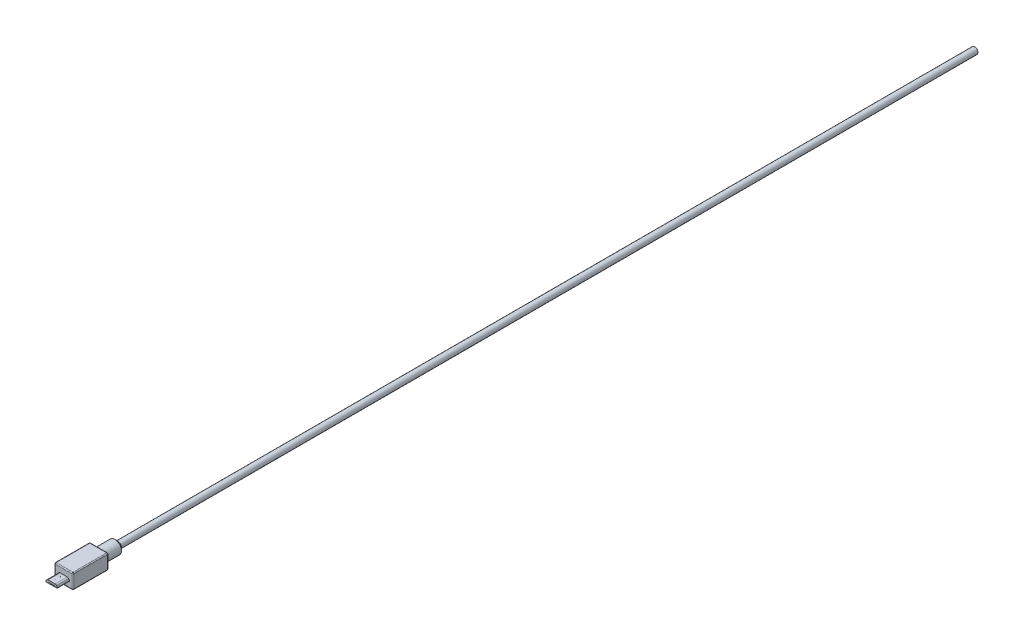
from build123d import *

# Parameters (mm, degrees)
SKETCH1_W                             = 10
SKETCH1_H                             = 19
MAIN_BODY_DEPTH                       = 8
WIRE_ENCAPSULATE_DEPTH                = 10
WIRE_ENCAPSULATE_DEPTH_BACK           = 2
SKETCH2_R                             = 3.5
WIRE_START_SIZE                       = 1.5
MUSB_CONNECTOR_PROFILE_EXTERNAL_DEPTH = 6.5
MUSB_CONNECTOR_PROFILE_INTERNAL_DEPTH = 6.5
SKETCH9_W                             = 3.5
SKETCH9_H                             = 0.5
PIN_ACCESS_DEPTH                      = 6.5
CONTACT_PIN_DEPTH                     = 6
CP_L_COUNT                            = 3
CP_L_PITCH                            = 0.5
CP_L_COL_COUNT                        = 3
CP_L_COL_PITCH                        = 0.5
SHEET_METAL_BOTTOM_MERGE_DEPTH        = 0.02
SKETCH27_W                            = 0.2
SKETCH27_H                            = 5.4
TAB_CUTOUT_DEPTH                      = 0.01
LOCKING_TAB_DEPTH                     = 0.2
WIRE_START                            = -479.5
WIRE_2_OUTLINE_R                      = 1.75
WIRE_2_DEPTH                          = 460
MB_F_R                                = 0.5


# Read off the part's stored shape, not the designer's step: WIRE
with BuildPart() as part:
    # Sketch1 → MAIN BODY (new body)
    with BuildSketch(Plane(origin=(0, 0, 0), x_dir=(1, 0, 0), z_dir=(0, 1, 0))):
        Rectangle(SKETCH1_W, SKETCH1_H)
    extrude(amount=MAIN_BODY_DEPTH)

    # Sketch2 → WIRE ENCAPSULATE (add, two sides: drawn at the far end of the back side and taken through both)
    with BuildSketch(Plane(origin=(0, 0, -9.5), x_dir=(-1, 0, 0), z_dir=(0, 0, -1)).offset(-WIRE_ENCAPSULATE_DEPTH_BACK)):
        with Locations((0, 4)):
            Circle(SKETCH2_R)
    extrude(amount=WIRE_ENCAPSULATE_DEPTH + WIRE_ENCAPSULATE_DEPTH_BACK)

    # WIRE START
    wire_start_edges = [part.edges().sort_by_distance(p)[0] for p in [
        (3.5, 4, -19.5),
    ]]
    chamfer(wire_start_edges, length=WIRE_START_SIZE)

    # WIRE 2 outline → WIRE 2 (add)
    with BuildSketch(Plane.XY.offset(WIRE_START)):
        with Locations((0, 4)):
            Circle(WIRE_2_OUTLINE_R)
    extrude(amount=WIRE_2_DEPTH)

    # MB F
    mb_f_edges = [part.edges().sort_by_distance(p)[0] for p in [
        (-5, 8, 0),
        (0, 8, 9.5),
        (5, 8, 0),
        (0, 0, 9.5),
        (-5, 0, 0),
        (0, 0, -9.5),
        (5, 0, 0),
        (0, 8, -9.5),
        (5, 4, 9.5),
        (-5, 4, 9.5),
        (-5, 4, -9.5),
        (5, 4, -9.5),
    ]]
    fillet(mb_f_edges, radius=MB_F_R - 0.0001)  # a hair under: the kernel refuses the full size


with BuildPart() as body_2:
    # Sketch6 → MUSB CONNECTOR PROFILE EXTERNAL (new body)
    with BuildSketch(Plane.XY.offset(9.5)):
        with BuildLine():
            Line((3.003298067, 3.35), (3.003298067, 3.59))
            ThreePointArc((3.003298067, 3.59), (2.926014523, 3.973517609), (2.707501676, 4.298033615))
            Line((2.707501676, 4.298033615), (2.544201676, 4.46))
            ThreePointArc((2.544201676, 4.46), (2.220788655, 4.6746621), (1.84, 4.75))
            Line((1.84, 4.75), (-1.84, 4.75))
            ThreePointArc((-1.84, 4.75), (-2.220788655, 4.6746621), (-2.544201676, 4.46))
            Line((-2.544201676, 4.46), (-2.707501676, 4.298033615))
            ThreePointArc((-2.707501676, 4.298033615), (-2.926014523, 3.973517609), (-3.003298067, 3.59))
            Line((-3.003298067, 3.59), (-3.003298067, 3.35))
            ThreePointArc((-3.003298067, 3.35), (-2.972852481, 3.278097248), (-2.9, 3.25))
            Line((-2.9, 3.25), (2.9, 3.25))
            ThreePointArc((2.9, 3.25), (2.972852481, 3.278097248), (3.003298067, 3.35))
        make_face()
    extrude(amount=MUSB_CONNECTOR_PROFILE_EXTERNAL_DEPTH)

    # Sketch7 → MUSB CONNECTOR PROFILE INTERNAL (cut)
    with BuildSketch(Plane.XY.offset(16)):
        with BuildLine():
            Line((2.700459659, 4.290933615), (2.537159659, 4.4529))
            ThreePointArc((2.537159659, 4.4529), (2.216980769, 4.665415479), (1.84, 4.74))
            Line((1.84, 4.74), (-1.84, 4.74))
            ThreePointArc((-1.84, 4.74), (-2.216980769, 4.665415479), (-2.537159659, 4.4529))
            Line((-2.537159659, 4.4529), (-2.700459659, 4.290933615))
            ThreePointArc((-2.700459659, 4.290933615), (-2.916785483, 3.969667304), (-2.993298076, 3.589990168))
            Line((-2.993298076, 3.589990168), (-2.993298067, 3.35))
            ThreePointArc((-2.993298067, 3.35), (-2.965841277, 3.285228144), (-2.900169294, 3.26))
            Line((-2.900169294, 3.26), (2.900169294, 3.26))
            ThreePointArc((2.900169294, 3.26), (2.96583932, 3.285226254), (2.993298068, 3.34999456))
            Line((2.993298068, 3.34999456), (2.993298076, 3.589990168))
            ThreePointArc((2.993298076, 3.589990168), (2.916785492, 3.969667308), (2.700459659, 4.290933615))
        make_face()
        with BuildLine():
            Line((2.693417642, 4.283833615), (2.530117642, 4.4458))
            ThreePointArc((2.530117642, 4.4458), (2.213172882, 4.656168858), (1.84, 4.73))
            Line((1.84, 4.73), (-1.84, 4.73))
            ThreePointArc((-1.84, 4.73), (-2.213172882, 4.656168858), (-2.530117642, 4.4458))
            Line((-2.530117642, 4.4458), (-2.693417642, 4.283833615))
            ThreePointArc((-2.693417642, 4.283833615), (-2.907556457, 3.965816966), (-2.983298076, 3.589980261))
            Line((-2.983298076, 3.589980261), (-2.983298067, 3.349996889))
            ThreePointArc((-2.983298067, 3.349996889), (-2.958832383, 3.292361385), (-2.900348288, 3.27))
            Line((-2.900348288, 3.27), (2.900348288, 3.27))
            ThreePointArc((2.900348288, 3.27), (2.958830536, 3.292359606), (2.983298068, 3.34999176))
            Line((2.983298068, 3.34999176), (2.983298076, 3.589980262))
            ThreePointArc((2.983298076, 3.589980262), (2.907556466, 3.965816969), (2.693417642, 4.283833614))
        make_face(mode=Mode.SUBTRACT)
    extrude(amount=-MUSB_CONNECTOR_PROFILE_INTERNAL_DEPTH, mode=Mode.SUBTRACT)


with BuildPart() as musb_connector_profile_internal_piece_1:
    # of the separate pieces the step leaves, piece 1, a body of its own (musb_connector_profile_internal_pieces)
    add(body_2.part.solids().sort_by_distance((2.983298068, 3.34999176, 9.5))[0])

    # Sketch9 → PIN ACCESS (cut)
    with BuildSketch(Plane.XY.offset(16)):
        with Locations((0, 3.52)):
            Rectangle(SKETCH9_W, SKETCH9_H)
    extrude(amount=-PIN_ACCESS_DEPTH, mode=Mode.SUBTRACT)


with BuildPart() as musb_connector_profile_internal_piece_2:
    # of the separate pieces the step leaves, piece 2, a body of its own (musb_connector_profile_internal_pieces)
    add(body_2.part.solids().sort_by_distance((3.003298067, 3.35, 9.5))[0])

    # Sketch26 → SHEET METAL BOTTOM MERGE (cut)
    with BuildSketch(Plane(origin=(0, 4.75, 0), x_dir=(1, 0, 0), z_dir=(0, 1, 0))):
        Polygon((0.29, -16), (0.29, -15), (-0.31, -15), (-0.31, -14), (0.29, -14), (0.29, -11.52), (-0.31, -11.52), (-0.31, -10.49), (0.29, -10.49), (0.29, -9.52), (0.31, -9.52), (0.31, -10.51), (-0.29, -10.51), (-0.29, -11.5), (0.31, -11.5), (0.31, -14.02), (-0.29, -14.02), (-0.29, -14.98), (0.31, -14.98), (0.31, -16), align=None)
    extrude(amount=-SHEET_METAL_BOTTOM_MERGE_DEPTH, mode=Mode.SUBTRACT)

    # Sketch27 → TAB CUTOUT (cut)
    with BuildSketch(Plane.XZ.offset(-3.25)):
        with Locations((-2.4, 12.75)):
            Rectangle(SKETCH27_W, SKETCH27_H)
    tab_cutout = extrude(amount=-TAB_CUTOUT_DEPTH, mode=Mode.SUBTRACT)

    # Sketch28 → LOCKING TAB (add)
    with BuildSketch(Plane(origin=(-2.5, 0, 0), x_dir=(0, 0, -1), z_dir=(1, 0, 0))):
        with BuildLine():
            Line((-14.930096163, 3.26), (-14.631394991, 2.958872768))
            ThreePointArc((-14.631394991, 2.958872768), (-14.598671734, 2.952260454), (-14.580096163, 2.98))
            Line((-14.580096163, 2.98), (-14.580096163, 3.26))
            Line((-14.580096163, 3.26), (-14.930096163, 3.26))
        make_face()
    locking_tab = extrude(amount=LOCKING_TAB_DEPTH)

    # Mirror1: TAB CUTOUT, LOCKING TAB across plane
    add(tab_cutout.mirror(Plane(origin=(0, 0, 0), x_dir=(0, 0, 1), z_dir=(1, 0, 0))), mode=Mode.SUBTRACT)
    add(locking_tab.mirror(Plane(origin=(0, 0, 0), x_dir=(0, 0, 1), z_dir=(1, 0, 0))))


with BuildPart() as body_4:
    # Sketch10 → CONTACT PIN (new body)
    with BuildSketch(Plane.XY.offset(9.5)):
        with BuildLine():
            Line((-0.1, 3.77), (0.1, 3.77))
            ThreePointArc((0.1, 3.77), (0, 3.67), (-0.1, 3.77))
        make_face()
    contact_pin = extrude(amount=CONTACT_PIN_DEPTH)


with BuildPart() as cp_l_1:
    # CP L: CONTACT PIN ×3
    with Locations(*[(-i * CP_L_PITCH, 0, 0) for i in range(1, CP_L_COUNT)]):
        add(contact_pin)


with BuildPart() as cp_l_col_1:
    # CP L col: CONTACT PIN ×3
    with Locations(*[(i * CP_L_COL_PITCH, 0, 0) for i in range(1, CP_L_COL_COUNT)]):
        add(contact_pin)


solid = Compound([part.part, musb_connector_profile_internal_piece_1.part, musb_connector_profile_internal_piece_2.part, body_4.part, cp_l_1.part, cp_l_col_1.part])
